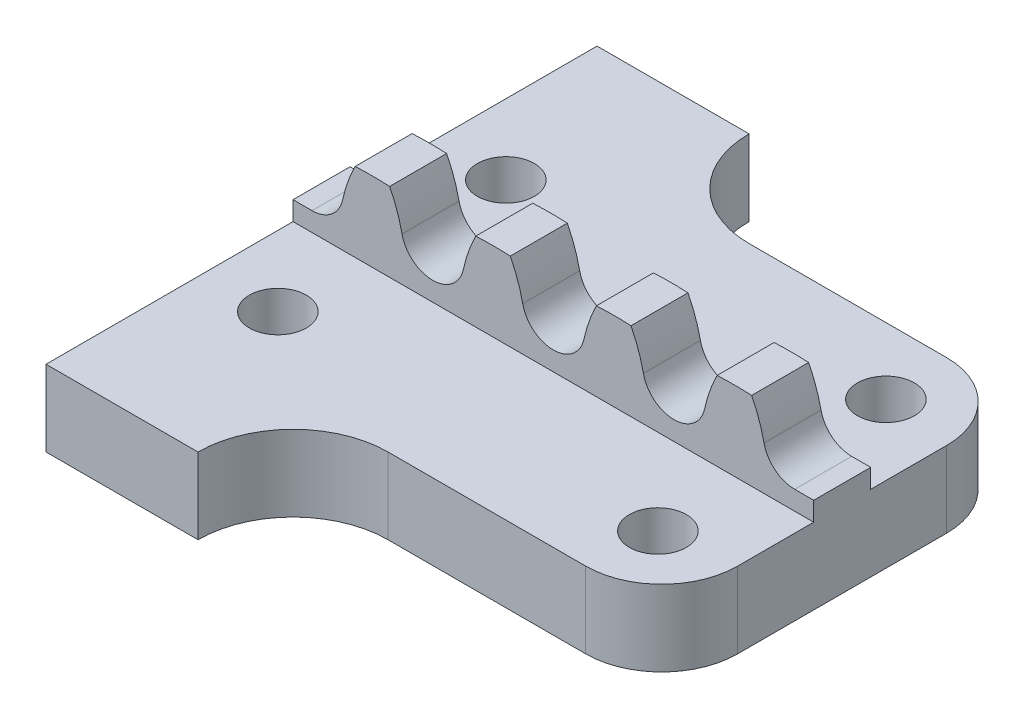
from build123d import *

# Parameters (mm, degrees)
SKETCH_1_W          = 27.399999997
SKETCH_1_H          = 4
EXTRUDE_1_DEPTH     = 3
SKETCH_1_3_W        = 27.399999997
SKETCH_1_3_H        = 4
EXTRUDE_2_DEPTH     = 11
SKETCH_1_4_W        = 27.399999997
SKETCH_1_4_H        = 4
EXTRUDE_3_DEPTH     = 8
SKETCH_2_R          = 1.5
CUT_EXTRUDE_1_DEPTH = 6.5
FILLET_1_R          = 4
EXTRUDE_4_DEPTH     = 19
SKETCH_6_W          = 32.257266432
SKETCH_6_H          = 23.708854684
CUT_EXTRUDE_2_DEPTH = 21
SKETCH_7_W          = 8
SKETCH_7_H          = 4
EXTRUDE_5_DEPTH     = 5
SKETCH_8_W          = 8
SKETCH_8_H          = 4
EXTRUDE_6_DEPTH     = 5
FILLET_2_R          = 5


with BuildPart() as part:
    # 草图1 → 凸台-拉伸1 (new body)
    with BuildSketch(Plane.XY):
        with BuildLine():
            ThreePointArc((-0.337371922, -1.853501365), (-0.488220409, -1.87454383), (-0.640366957, -1.881577989))
            Line((-0.640366957, -1.881577989), (-1.640366957, -1.881577989))
            Line((-1.640366957, -1.881577989), (-1.640366957, -2.881577989))
            Line((-1.640366957, -2.881577989), (25.75963304, -2.881577989))
            Line((25.75963304, -2.881577989), (25.75963304, -1.88157799))
            Line((25.75963304, -1.88157799), (24.75963304, -1.88157799))
            ThreePointArc((24.75963304, -1.88157799), (24.607486492, -1.87454383), (24.456638005, -1.853501365))
            ThreePointArc((24.456638005, -1.853501365), (23.608703525, -1.413476758), (23.147062635, -0.577114262))
            ThreePointArc((23.147062635, -0.577114262), (22.880535784, 0.365382964), (22.493851477, 1.265278974))
            ThreePointArc((22.493851477, 1.265278974), (21.584633042, 1.287629087), (20.675414607, 1.265278974))
            ThreePointArc((20.675414607, 1.265278974), (20.288730299, 0.365382964), (20.022203448, -0.577114261))
            ThreePointArc((20.022203448, -0.577114261), (19.560562558, -1.413476758), (18.712628078, -1.853501365))
            ThreePointArc((18.712628078, -1.853501365), (18.409633042, -1.88157799), (18.106638005, -1.853501365))
            ThreePointArc((18.106638005, -1.853501365), (17.258703525, -1.413476758), (16.797062635, -0.577114262))
            ThreePointArc((16.797062635, -0.577114262), (16.530535784, 0.365382964), (16.143851477, 1.265278974))
            ThreePointArc((16.143851477, 1.265278974), (15.234633042, 1.287629087), (14.325414607, 1.265278974))
            ThreePointArc((14.325414607, 1.265278974), (13.938730299, 0.365382964), (13.672203448, -0.577114261))
            ThreePointArc((13.672203448, -0.577114261), (13.210562558, -1.413476758), (12.362628078, -1.853501365))
            ThreePointArc((12.362628078, -1.853501365), (12.059633042, -1.88157799), (11.756638005, -1.853501365))
            ThreePointArc((11.756638005, -1.853501365), (10.908703525, -1.413476758), (10.447062635, -0.577114262))
            ThreePointArc((10.447062635, -0.577114262), (10.180535784, 0.365382964), (9.793851477, 1.265278974))
            ThreePointArc((9.793851477, 1.265278974), (8.884633042, 1.287629087), (7.975414607, 1.265278974))
            ThreePointArc((7.975414607, 1.265278974), (7.588730299, 0.365382964), (7.322203448, -0.577114261))
            ThreePointArc((7.322203448, -0.577114261), (6.860562558, -1.413476758), (6.012628078, -1.853501365))
            ThreePointArc((6.012628078, -1.853501365), (5.709633042, -1.88157799), (5.406638005, -1.853501365))
            ThreePointArc((5.406638005, -1.853501365), (4.558703525, -1.413476758), (4.097062635, -0.577114262))
            ThreePointArc((4.097062635, -0.577114262), (3.830535784, 0.365382964), (3.443851477, 1.265278974))
            ThreePointArc((3.443851477, 1.265278974), (2.534633042, 1.287629087), (1.625414607, 1.265278974))
            ThreePointArc((1.625414607, 1.265278974), (1.238730299, 0.365382964), (0.972203448, -0.577114261))
            ThreePointArc((0.972203448, -0.577114261), (0.510562558, -1.413476758), (-0.337371922, -1.853501365))
        make_face()
        with Locations((12.059633041, -4.881577989)):
            Rectangle(SKETCH_1_W, SKETCH_1_H)
    extrude(amount=EXTRUDE_1_DEPTH)

    # 草图1<3> → 凸台-拉伸2 (add)
    with BuildSketch(Plane.XY):
        with Locations((12.059633041, -4.881577989)):
            Rectangle(SKETCH_1_3_W, SKETCH_1_3_H)
    extrude(amount=EXTRUDE_2_DEPTH)

    # 草图1<4> → 凸台-拉伸3 (add)
    with BuildSketch(Plane.XY):
        with Locations((12.059633041, -4.881577989)):
            Rectangle(SKETCH_1_4_W, SKETCH_1_4_H)
    extrude(amount=-EXTRUDE_3_DEPTH)

    # 草图2 → 切除-拉伸1 (cut)
    with BuildSketch(Plane(origin=(0, -2.881577989, 0), x_dir=(1, 0, 0), z_dir=(0, 1, 0))):
        with Locations(Location((2.059633042, 4.5, 0), (0, 0, 270))):
            Circle(SKETCH_2_R)
        with Locations(Location((22.059633042, 4.5, 0), (0, 0, 270))):
            Circle(SKETCH_2_R)
        with Locations(Location((22.059633042, -7.5, 0), (0, 0, 270))):
            Circle(SKETCH_2_R)
        with Locations(Location((2.059633042, -7.5, 0), (0, 0, 270))):
            Circle(SKETCH_2_R)
    extrude(amount=-CUT_EXTRUDE_1_DEPTH, mode=Mode.SUBTRACT)

    # 圆角1
    fillet_1_edges = [part.edges().sort_by_distance(p)[0] for p in [
        (25.75963304, -4.881577989, 11),
        (25.75963304, -4.881577989, -8),
    ]]
    fillet(fillet_1_edges, radius=FILLET_1_R)

    # 草图4 → 凸台-拉伸4 (add)
    with BuildSketch(Plane(origin=(0, 0, -8), x_dir=(-1, 0, 0), z_dir=(0, 0, -1))):
        with BuildLine():
            Line((-7.559633042, -6.881577989), (-12.559633042, -6.881577989))
            Line((-12.559633042, -6.881577989), (-12.559633042, -12.881577989))
            ThreePointArc((-12.559633042, -12.881577989), (-9.530706272, -19.615542978), (-2.482680937, -21.816910897))
            Line((-2.482680937, -21.816910897), (-2.482680937, -19.612245623))
            ThreePointArc((-2.482680937, -19.612245623), (-6.148073578, -17.096946581), (-7.559633042, -12.881577989))
            Line((-7.559633042, -12.881577989), (-7.559633042, -6.881577989))
        make_face()
    extrude(amount=-EXTRUDE_4_DEPTH)

    # 草图6 → 切除-拉伸2 (cut)
    with BuildSketch(Plane.XZ.offset(6.881577989)):
        with Locations((13.405653676, 0.508195322)):
            Rectangle(SKETCH_6_W, SKETCH_6_H)
    extrude(amount=CUT_EXTRUDE_2_DEPTH, mode=Mode.SUBTRACT)

    # 草图7 → 凸台-拉伸5 (add)
    with BuildSketch(Plane.XY.offset(11)):
        with Locations((2.359633043, -4.881577989)):
            Rectangle(SKETCH_7_W, SKETCH_7_H)
    extrude(amount=EXTRUDE_5_DEPTH)

    # 草图8 → 凸台-拉伸6 (add)
    with BuildSketch(Plane(origin=(0, 0, -8), x_dir=(-1, 0, 0), z_dir=(0, 0, -1))):
        with Locations((-2.359633043, -4.881577989)):
            Rectangle(SKETCH_8_W, SKETCH_8_H)
    extrude(amount=EXTRUDE_6_DEPTH)

    # 圆角2
    fillet_2_edges = [part.edges().sort_by_distance(p)[0] for p in [
        (6.359633043, -4.881577989, 11),
        (6.359633043, -4.881577989, -8),
    ]]
    fillet(fillet_2_edges, radius=FILLET_2_R - 0.0001)  # a hair under: the kernel refuses the full size


solid = part.part
